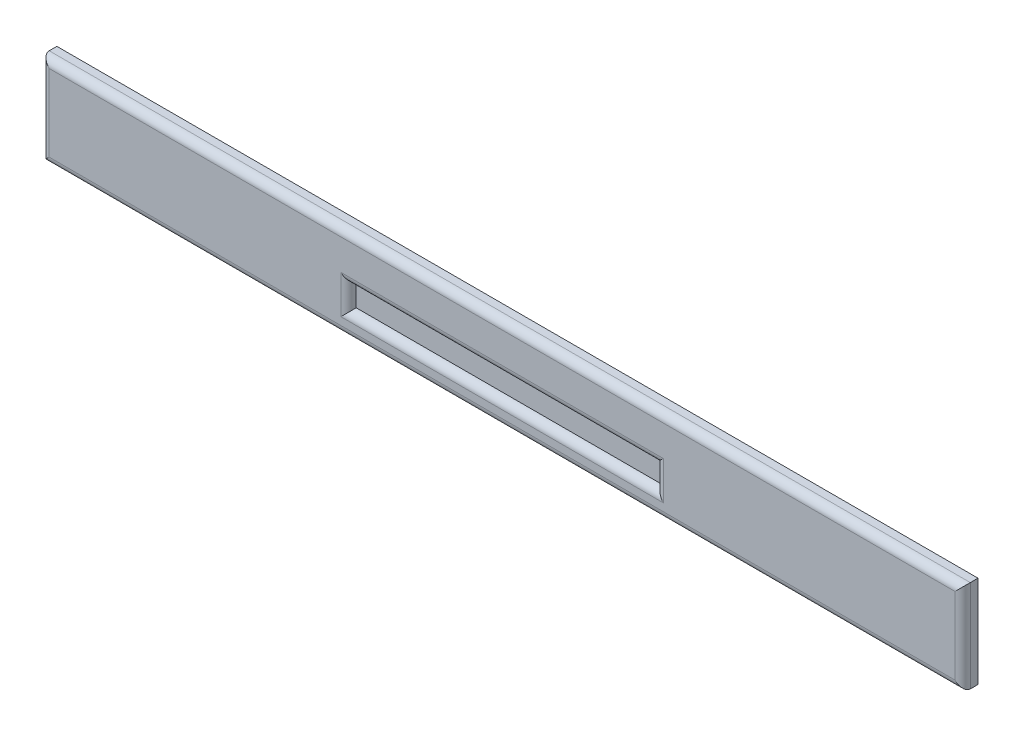
from build123d import *

# Parameters (mm, degrees)
SKETCH1_W           = 6000
SKETCH1_H           = 600
BOSS_EXTRUDE1_DEPTH = 100
SKETCH2_W           = 2000
SKETCH2_H           = 150
CUT_EXTRUDE1_DEPTH  = 50
FILLET2_R           = 50


with BuildPart() as part:
    # Sketch1 → Boss-Extrude1 (new body)
    with BuildSketch(Plane.XY):
        with Locations((-3000, 300)):
            Rectangle(SKETCH1_W, SKETCH1_H)
    extrude(amount=BOSS_EXTRUDE1_DEPTH)

    # Sketch2 → Cut-Extrude1 (cut)
    with BuildSketch(Plane.XY.offset(100)):
        with Locations((-3000, 225)):
            Rectangle(SKETCH2_W, SKETCH2_H)
    extrude(amount=-CUT_EXTRUDE1_DEPTH, mode=Mode.SUBTRACT)

    # Fillet2
    fillet2_edges = [part.edges().sort_by_distance(p)[0] for p in [
        (-3000, 0, 100),
        (-6000, 300, 100),
        (-3000, 600, 100),
        (0, 300, 100),
        (-3000, 300, 100),
        (-4000, 225, 100),
        (-3000, 150, 100),
        (-2000, 225, 100),
    ]]
    fillet(fillet2_edges, radius=FILLET2_R - 0.0001)  # a hair under: the kernel refuses the full size


solid = part.part
